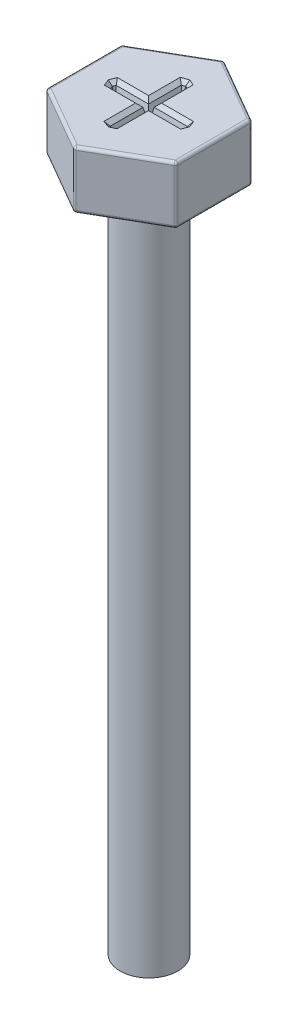
from build123d import *

# Parameters (mm, degrees)
SKETCH1_R           = 2
BOSS_EXTRUDE1_DEPTH = 47
BOSS_EXTRUDE2_DEPTH = 4
FILLET1_R           = 0.2
CUT_EXTRUDE2_DEPTH  = 1
CUT_EXTRUDE2_DRAFT  = -12
CHAMFER1_SIZE       = 0.2
CHAMFER1_SIZE2      = 0.259660706


with BuildPart() as part:
    # Sketch1 → Boss-Extrude1 (new body)
    with BuildSketch(Plane(origin=(0, 0, 0), x_dir=(1, 0, 0), z_dir=(0, 1, 0))):
        Circle(SKETCH1_R)
    extrude(amount=-BOSS_EXTRUDE1_DEPTH)

    # Sketch2 → Boss-Extrude2 (add)
    with BuildSketch(Plane(origin=(0, 0, 0), x_dir=(1, 0, 0), z_dir=(0, 1, 0))):
        Polygon((0, 5.196152423), (-4.5, 2.598076211), (-4.5, -2.598076211), (0, -5.196152423), (4.5, -2.598076211), (4.5, 2.598076211), align=None)
    extrude(amount=BOSS_EXTRUDE2_DEPTH)

    # Fillet1
    fillet1_edges = [part.edges().sort_by_distance(p)[0] for p in [
        (2.25, 0, -3.897114317),
        (-2.25, 0, -3.897114317),
        (-4.5, 0, 0),
        (-2.25, 0, 3.897114317),
        (2.25, 0, 3.897114317),
        (4.5, 0, 0),
        (2.25, 4, -3.897114317),
        (-2.25, 4, -3.897114317),
        (-4.5, 4, 0),
        (-2.25, 4, 3.897114317),
        (2.25, 4, 3.897114317),
        (4.5, 2, -2.598076211),
        (4.5, 2, 2.598076211),
        (0, 2, 5.196152423),
        (-4.5, 2, 2.598076211),
        (-4.5, 2, -2.598076211),
        (0, 2, -5.196152423),
        (4.5, 4, 0),
    ]]
    fillet(fillet1_edges, radius=FILLET1_R)


with BuildPart() as cut_extrude2_tool:
    # Sketch3 → Cut-Extrude2 (with draft: the straight prism first)
    with BuildSketch(Plane(origin=(0, 4, 0), x_dir=(1, 0, 0), z_dir=(0, 1, 0))):
        Polygon((0, 2.6), (-0.280523914, 2.5), (-0.280523914, 0.25), (-2.5, 0.25), (-2.6, 0), (-2.5, -0.25), (-0.280523914, -0.25), (-0.280523914, -2.5), (0, -2.6), (0.219476086, -2.5), (0.219476086, -0.25), (2.5, -0.25), (2.6, 0), (2.5, 0.25), (0.219476086, 0.25), (0.219476086, 2.5), align=None)
    extrude(amount=-CUT_EXTRUDE2_DEPTH)
    # Cut-Extrude2: the draft: its side faces are tilted about the plane it starts from
    cut_extrude2_sides = [cut_extrude2_tool.faces().sort_by_distance(p)[0] for p in [
        (-0.140261957, 3.5, -2.55),
        (-0.280523914, 3.5, -1.375),
        (-1.390261957, 3.5, -0.25),
        (-2.55, 3.5, -0.125),
        (-2.55, 3.5, 0.125),
        (-1.390261957, 3.5, 0.25),
        (-0.280523914, 3.5, 1.375),
        (-0.140261957, 3.5, 2.55),
        (0.109738043, 3.5, 2.55),
        (0.219476086, 3.5, 1.375),
        (1.359738043, 3.5, 0.25),
        (2.55, 3.5, 0.125),
        (2.55, 3.5, -0.125),
        (1.359738043, 3.5, -0.25),
        (0.219476086, 3.5, -1.375),
        (0.109738043, 3.5, -2.55),
    ]]
    draft(cut_extrude2_sides, Plane(origin=(0, 4, 0), x_dir=(1, 0, 0), z_dir=(0, 1, 0)), CUT_EXTRUDE2_DRAFT)


with BuildPart() as part_1:
    add(part.part)

    # Cut-Extrude2: cut by cut_extrude2_tool
    add(cut_extrude2_tool.part, mode=Mode.SUBTRACT)

    # Chamfer1
    chamfer1_edges = [part_1.edges().sort_by_distance(p)[0] for p in [
        (0.109738043, 4, 2.55),
        (-0.140261957, 4, 2.55),
        (-0.280523914, 4, 1.375),
        (0.219476086, 4, 1.375),
        (1.359738043, 4, 0.25),
        (2.55, 4, 0.125),
        (2.55, 4, -0.125),
        (1.359738043, 4, -0.25),
        (0.219476086, 4, -1.375),
        (0.109738043, 4, -2.55),
        (-0.140261957, 4, -2.55),
        (-0.280523914, 4, -1.375),
        (-1.390261957, 4, 0.25),
        (-2.55, 4, 0.125),
        (-2.55, 4, -0.125),
        (-1.390261957, 4, -0.25),
    ]]
    chamfer1_side = [part_1.faces().sort_by_distance(p)[0] for p in [
        (2.084316415, 4, -3.61014193),
    ]]
    chamfer(chamfer1_edges, length=CHAMFER1_SIZE, length2=CHAMFER1_SIZE2, reference=chamfer1_side[0])


solid = part_1.part
